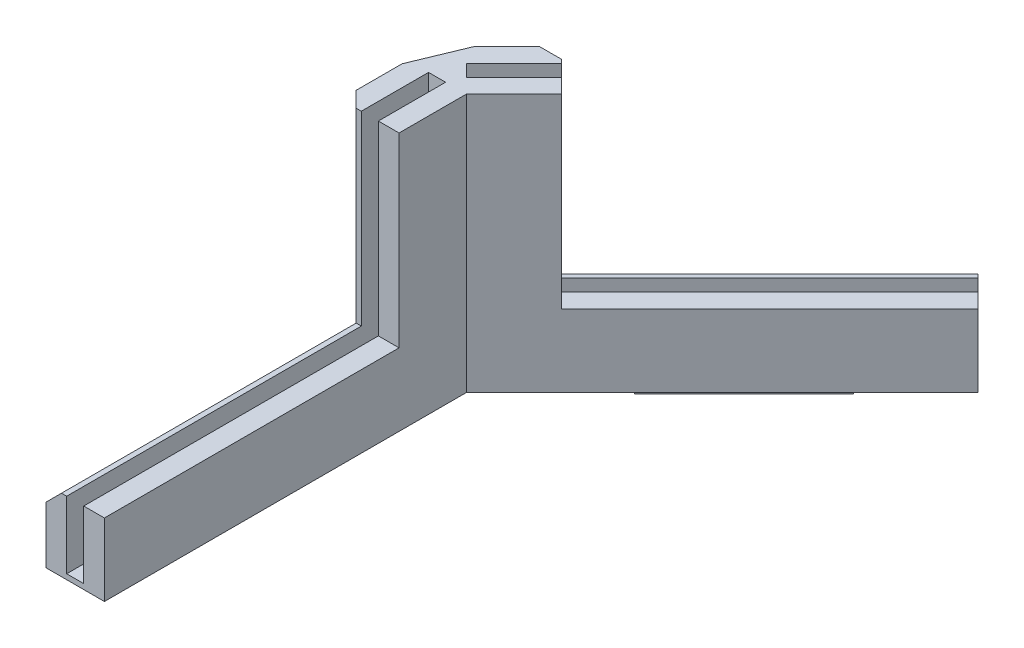
from build123d import *

# Parameters (mm, degrees)
BOSS_EXTRUDE1_DEPTH = 50
SKETCH3_W           = 3.3
SKETCH3_H           = 1
BOSS_EXTRUDE2_DEPTH = 13
BOSS_EXTRUDE3_DEPTH = 57
SKETCH6_W           = 2
SKETCH6_H           = 30
BOSS_EXTRUDE4_DEPTH = 2
CHAMFER1_START      = -14
CHAMFER1_OUTLINE_W  = 52
CHAMFER1_OUTLINE_H  = 13
CHAMFER1_DEPTH      = 3.182909169
CHAMFER2_SIZE       = 3


with BuildPart() as part:
    # Sketch2 → Boss-Extrude1 (new body)
    with BuildSketch(Plane(origin=(0, 0, 0), x_dir=(1, 0, 0), z_dir=(0, 1, 0))):
        Polygon((-1.7, -2), (-1.7, -15), (-5.7, -15), (-5.7, -2), (-9, -2), (-9, -15), (-13, -15), (-13, 2.680601608), align=None)
    extrude(amount=BOSS_EXTRUDE1_DEPTH)

    # Sketch3 → Boss-Extrude2 (add)
    with BuildSketch(Plane.XY.offset(2)):
        with Locations((-7.35, 0.5)):
            Rectangle(SKETCH3_W, SKETCH3_H)
    extrude(amount=BOSS_EXTRUDE2_DEPTH)

    # Sketch5 → Boss-Extrude3 (add)
    with BuildSketch(Plane.XY.offset(15)):
        Polygon((-13, 0), (-1.7, 0), (-1.7, 14), (-5.7, 14), (-5.7, 1), (-9, 1), (-9, 14), (-13, 14), align=None)
    extrude(amount=BOSS_EXTRUDE3_DEPTH)

    # Sketch6 → Boss-Extrude4 (add)
    with BuildSketch(Plane(origin=(0, 0, 0), x_dir=(-1, 0, 0), z_dir=(0, -1, 0))):
        with Locations((5.2, -40)):
            Rectangle(SKETCH6_W, SKETCH6_H)
        with Locations((9.5, -40)):
            Rectangle(SKETCH6_W, SKETCH6_H)
    extrude(amount=BOSS_EXTRUDE4_DEPTH)

    # Mirror1: part across plane


with BuildPart() as part_1:
    add(part.part)
    add(part.part.mirror(Plane(origin=(-0.956063716, 0, 2.308147732), x_dir=(0.9238798691632129, 0, 0.38268261961443256), z_dir=(0.3826826196144326, 0, -0.9238798691632131))))

    # Chamfer1: read off the stored shape, not the designer's step
    # Chamfer1 outline → Chamfer1 (cut)
    with BuildSketch(Plane(origin=(0, 0, 0), x_dir=(0, 1, 0), z_dir=(0.9238798691632129, 0, 0.38268261961443295)).offset(CHAMFER1_START)):
        with Locations((25, 2.5)):
            Rectangle(CHAMFER1_OUTLINE_W, CHAMFER1_OUTLINE_H)
    extrude(amount=CHAMFER1_DEPTH, mode=Mode.SUBTRACT)

    # Chamfer2
    chamfer2_edges = [part_1.edges().sort_by_distance(p)[0] for p in [
        (-13, 32, 15),
        (-13, 14, 43.5),
        (-0.497948704, 32, -15.182696898),
        (19.654559103, 14, -35.335275619),
    ]]
    chamfer(chamfer2_edges, length=CHAMFER2_SIZE)


solid = part_1.part
